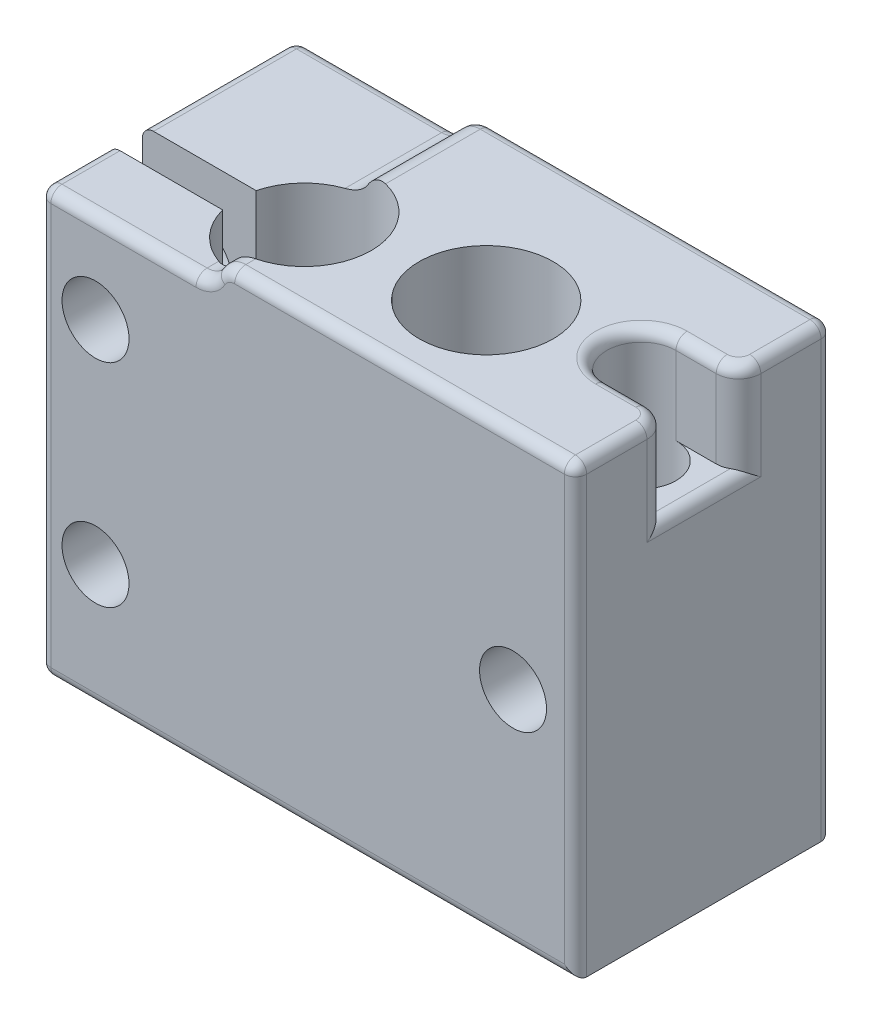
from build123d import *

# Parameters (mm, degrees)
DODANIE_WYCI_GNI_CIE1_DEPTH = 20
WYTNIJ_WYCI_GNI_CIE1_DEPTH  = 4
SZKIC2_W                    = 8
SZKIC2_H                    = 1
WYTNIJ_WYCI_GNI_CIE2_DEPTH  = 27.004807248
SZKIC2_3_R                  = 1.5
WYTNIJ_WYCI_GNI_CIE3_DEPTH  = 5.5
SZKIC2_4_R                  = 1.5
WYTNIJ_WYCI_GNI_CIE4_DEPTH  = 27.004807325
ZAOKR_GLENIE1_R             = 1
ZAOKR_GLENIE2_R             = 1
ZAOKR_GLENIE3_R             = 1
ZAOKR_GLENIE4_R             = 0.5
ZAOKR_GLENIE5_R             = 0.5


with BuildPart() as part:
    # Szkic1 → Dodanie-wyciągnięcie1 (new body)
    with BuildSketch(Plane(origin=(0, 0, 0), x_dir=(1, 0, 0), z_dir=(0, 1, 0))):
        with BuildLine():
            Line((9.2, 1.55), (12, 1.55))
            Line((12, 1.55), (12, 5.75))
            Line((12, 5.75), (-12, 5.75))
            Line((-12, 5.75), (-12, 0))
            Line((-12, 0), (-6.321637353, 0))
            ThreePointArc((-6.321637353, 0), (-4, 1.1), (-1.678362647, 0))
            Line((-1.678362647, 0), (0.772821971, 0))
            ThreePointArc((0.772821971, 0), (3.5, 1.75), (6.227178029, 0))
            Line((6.227178029, 0), (7.65, 0))
            ThreePointArc((7.65, 0), (8.103984489, 1.096015511), (9.2, 1.55))
        make_face()
        with BuildLine():
            Line((-6.321637353, 0), (-12, 0))
            Line((-12, 0), (-12, -1.15))
            Line((-12, -1.15), (-6.90473751, -1.15))
            ThreePointArc((-6.90473751, -1.15), (-6.675700572, -0.543303111), (-6.321637353, 0))
        make_face()
        with BuildLine():
            Line((12, -5.75), (12, -1.55))
            Line((12, -1.55), (9.2, -1.55))
            ThreePointArc((9.2, -1.55), (8.103984489, -1.096015511), (7.65, 0))
            Line((7.65, 0), (6.227178029, 0))
            ThreePointArc((6.227178029, 0), (6.431001031, -0.610286817), (6.5, -1.25))
            ThreePointArc((6.5, -1.25), (2.860286817, -4.181001031), (0.772821971, 0))
            Line((0.772821971, 0), (-1.678362647, 0))
            ThreePointArc((-1.678362647, 0), (-2.643303111, -4.575700572), (-6.90473751, -2.65))
            Line((-6.90473751, -2.65), (-12, -2.65))
            Line((-12, -2.65), (-12, -5.75))
            Line((-12, -5.75), (12, -5.75))
        make_face()
        with BuildLine():
            Line((12, -1.55), (12, 0))
            Line((12, 0), (10.75, 0))
            ThreePointArc((10.75, 0), (10.296015511, -1.096015511), (9.2, -1.55))
            Line((9.2, -1.55), (12, -1.55))
        make_face()
        with BuildLine():
            Line((10.75, 0), (12, 0))
            Line((12, 0), (12, 1.55))
            Line((12, 1.55), (9.2, 1.55))
            ThreePointArc((9.2, 1.55), (10.296015511, 1.096015511), (10.75, 0))
        make_face()
    extrude(amount=-DODANIE_WYCI_GNI_CIE1_DEPTH)

    # Szkic1<4> → Wytnij-wyciągnięcie1 (cut)
    with BuildSketch(Plane(origin=(0, 0, 0), x_dir=(1, 0, 0), z_dir=(0, 1, 0))):
        with BuildLine():
            Line((10.75, 0), (12, 0))
            Line((12, 0), (12, 1.55))
            Line((12, 1.55), (9.2, 1.55))
            ThreePointArc((9.2, 1.55), (10.296015511, 1.096015511), (10.75, 0))
        make_face()
        with BuildLine():
            Line((12, -1.55), (12, 0))
            Line((12, 0), (10.75, 0))
            ThreePointArc((10.75, 0), (10.296015511, -1.096015511), (9.2, -1.55))
            Line((9.2, -1.55), (12, -1.55))
        make_face()
    extrude(amount=-WYTNIJ_WYCI_GNI_CIE1_DEPTH, mode=Mode.SUBTRACT)

    # Szkic2 → Wytnij-wyciągnięcie2 (cut, through all)
    with BuildSketch(Plane.XY.offset(5.75)):
        with Locations((-8, -0.5)):
            Rectangle(SZKIC2_W, SZKIC2_H)
    extrude(amount=-WYTNIJ_WYCI_GNI_CIE2_DEPTH, mode=Mode.SUBTRACT)

    # Szkic2<3> → Wytnij-wyciągnięcie3 (cut)
    with BuildSketch(Plane.XY.offset(5.75)):
        with Locations((9.2, -10)):
            Circle(SZKIC2_3_R)
    extrude(amount=-WYTNIJ_WYCI_GNI_CIE3_DEPTH, mode=Mode.SUBTRACT)

    # Szkic2<4> → Wytnij-wyciągnięcie4 (cut, through all)
    with BuildSketch(Plane.XY.offset(5.75)):
        with Locations((-9.5, -5)):
            Circle(SZKIC2_4_R)
        with Locations((-9.5, -14.5)):
            Circle(SZKIC2_4_R)
    extrude(amount=-WYTNIJ_WYCI_GNI_CIE4_DEPTH, mode=Mode.SUBTRACT)

    # Zaokrąglenie1
    zaokr_glenie1_edges = [part.edges().sort_by_distance(p)[0] for p in [
        (-4, -1, -3.425),
        (-4, -1, 5.325),
    ]]
    fillet(zaokr_glenie1_edges, radius=ZAOKR_GLENIE1_R - 0.0001)  # a hair under: the kernel refuses the full size

    # Zaokrąglenie2
    zaokr_glenie2_edges = [part.edges().sort_by_distance(p)[0] for p in [
        (-4, 0, 5.325),
        (-4, 0, -3.425),
    ]]
    fillet(zaokr_glenie2_edges, radius=ZAOKR_GLENIE2_R)

    # Zaokrąglenie3
    zaokr_glenie3_edges = [part.edges().sort_by_distance(p)[0] for p in [
        (12, -2, -1.55),
        (12, -2, 1.55),
    ]]
    fillet(zaokr_glenie3_edges, radius=ZAOKR_GLENIE3_R)

    # Zaokrąglenie4
    zaokr_glenie4_edges = [part.edges().sort_by_distance(p)[0] for p in [
        (-4.499937501, -0.866031585, -5.75),
        (-4.499937501, -0.866031585, 5.75),
        (-3.767919429, -0.133981813, 5.75),
        (-3.767919429, -0.133981813, -5.75),
        (12, 0, -4.15),
        (11.707106781, 0, -1.842893219),
        (11.707106781, 0, 1.842893219),
        (4.366046536, 0, -5.75),
        (12, 0, 4.15),
        (4.366046536, 0, 5.75),
        (0, -20, 5.75),
        (-12, -10.5, 5.75),
        (-12, -10.5, -5.75),
        (12, -10, -5.75),
        (12, -10, 5.75),
        (0, -20, -5.75),
        (-12, -20, -2.3),
        (7.65, 0, 0),
        (10.1, 0, -1.55),
        (10.1, 0, 1.55),
        (-12, -20, 4.2),
        (-8.49995, -1, -5.75),
        (-12, -1, 4.2),
        (-12, -1, -2.3),
        (-8.49995, -1, 5.75),
    ]]
    fillet(zaokr_glenie4_edges, radius=ZAOKR_GLENIE4_R)

    # Zaokrąglenie5
    zaokr_glenie5_edges = [part.edges().sort_by_distance(p)[0] for p in [
        (12, -4, 0),
    ]]
    fillet(zaokr_glenie5_edges, radius=ZAOKR_GLENIE5_R)


solid = part.part
